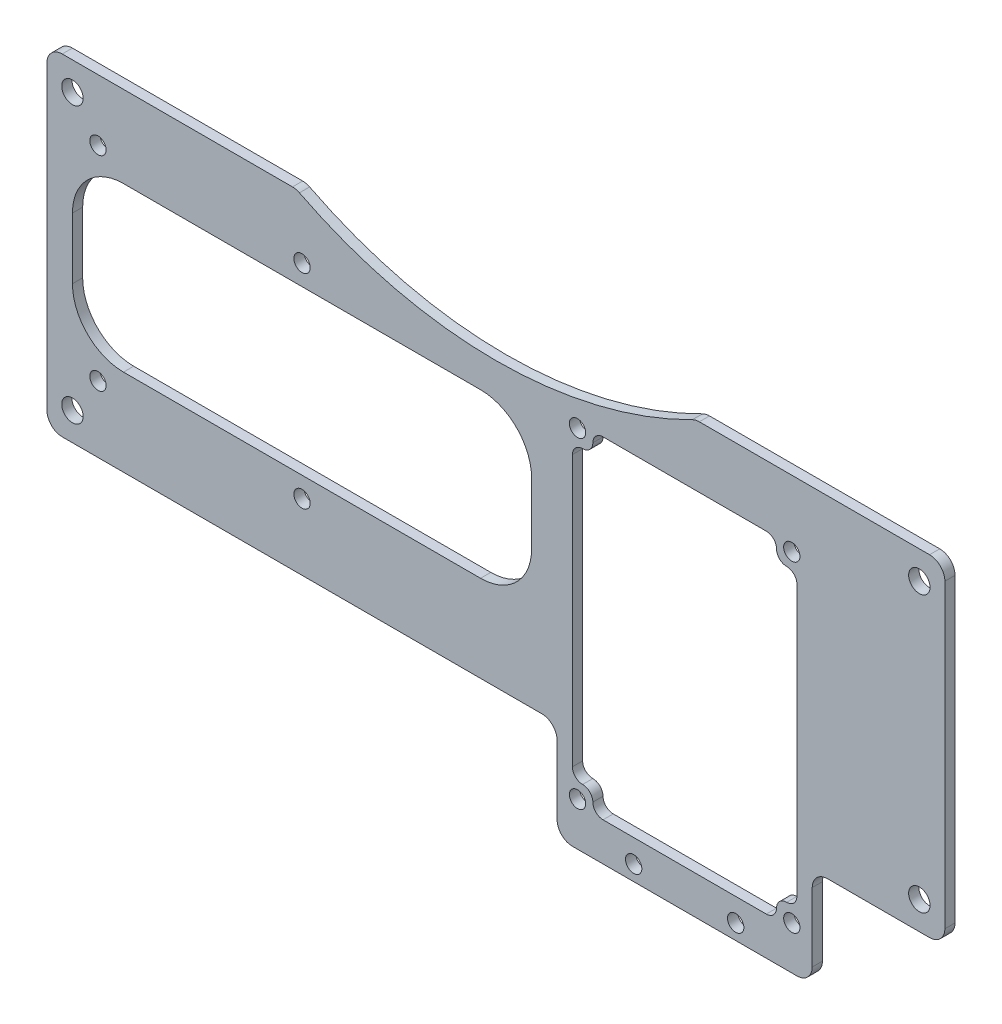
from build123d import *

# Parameters (mm, degrees)
SKETCH_1_W          = 176
SKETCH_1_H          = 65
SKETCH_1_R          = 2.1
EXTRUDE_1_DEPTH     = 2
FILLET_1_R          = 3
SKETCH_2_R          = 85
CUT_EXTRUDE_1_DEPTH = 24
SKETCH_4_W          = 50
SKETCH_4_H          = 19.5
EXTRUDE_2_DEPTH     = 2
FILLET_2_R          = 3
SKETCH_3_R          = 1.6
CUT_EXTRUDE_2_DEPTH = 12
FILLET_3_R          = 2
SKETCH_5_R          = 1.6
CUT_EXTRUDE_3_DEPTH = 12
SKETCH_6_R          = 1.6
CUT_EXTRUDE_4_DEPTH = 12
SKETCH_7_W          = 90
SKETCH_7_H          = 32
CUT_EXTRUDE_5_DEPTH = 10
FILLET_4_R          = 10


with BuildPart() as part:
    # 草图1 → 凸台-拉伸1 (new body)
    with BuildSketch(Plane.XY):
        Rectangle(SKETCH_1_W, SKETCH_1_H)
        with Locations((-83, 27)):
            Circle(SKETCH_1_R, mode=Mode.SUBTRACT)
        with Locations((-83, -27)):
            Circle(SKETCH_1_R, mode=Mode.SUBTRACT)
        with Locations(Location((83, -27, 0), (0, 0, 180))):
            Circle(SKETCH_1_R, mode=Mode.SUBTRACT)
        with Locations(Location((83, 27, 0), (0, 0, 180))):
            Circle(SKETCH_1_R, mode=Mode.SUBTRACT)
    extrude(amount=EXTRUDE_1_DEPTH)

    # 圆角1
    fillet_1_edges = [part.edges().sort_by_distance(p)[0] for p in [
        (-88, 32.5, 1),
        (88, 32.5, 1),
        (88, -32.5, 1),
        (-88, -32.5, 1),
    ]]
    fillet(fillet_1_edges, radius=FILLET_1_R)

    # 草图2 → 切除-拉伸1 (cut)
    with BuildSketch(Plane.XY.offset(2)):
        with Locations((0, 107.95)):
            Circle(SKETCH_2_R)
    extrude(amount=-CUT_EXTRUDE_1_DEPTH, mode=Mode.SUBTRACT)

    # 草图4 → 凸台-拉伸2 (add)
    with BuildSketch(Plane.XY.offset(2)):
        with Locations((37, -42.25)):
            Rectangle(SKETCH_4_W, SKETCH_4_H)
    extrude(amount=-EXTRUDE_2_DEPTH)

    # 圆角2
    fillet_2_edges = [part.edges().sort_by_distance(p)[0] for p in [
        (-39.144571782, 32.5, 1),
        (39.144571782, 32.5, 1),
        (12, -52, 1),
        (12, -32.5, 1),
        (62, -32.5, 1),
        (62, -52, 1),
    ]]
    fillet(fillet_2_edges, radius=FILLET_2_R)

    # 草图3 → 切除-拉伸2 (cut)
    with BuildSketch(Plane.XY.offset(2)):
        with Locations((16, 19.5)):
            Circle(SKETCH_3_R)
        with Locations((58, 19.5)):
            Circle(SKETCH_3_R)
        with Locations((58, -43.5)):
            Circle(SKETCH_3_R)
        with Locations((16, -43.5)):
            Circle(SKETCH_3_R)
        Polygon((19, 20.5), (19, 16.5), (15, 16.5), (15, -40.5), (19, -40.5), (19, -44.5), (55, -44.5), (55, -40.5), (59, -40.5), (59, 16.5), (55, 16.5), (55, 20.5), align=None)
    extrude(amount=-CUT_EXTRUDE_2_DEPTH, mode=Mode.SUBTRACT)

    # 圆角3
    fillet_3_edges = [part.edges().sort_by_distance(p)[0] for p in [
        (55, 16.5, 1),
        (59, 16.5, 1),
        (59, -40.5, 1),
        (55, -40.5, 1),
        (55, -44.5, 1),
        (19, -44.5, 1),
        (19, -40.5, 1),
        (15, -40.5, 1),
        (19, 16.5, 1),
        (19, 20.5, 1),
        (55, 20.5, 1),
        (15, 16.5, 1),
    ]]
    fillet(fillet_3_edges, radius=FILLET_3_R - 0.0001)  # a hair under: the kernel refuses the full size

    # 草图5 → 切除-拉伸3 (cut)
    with BuildSketch(Plane.XY.offset(2)):
        with Locations((27, -49)):
            Circle(SKETCH_5_R)
        with Locations((47, -49)):
            Circle(SKETCH_5_R)
    extrude(amount=-CUT_EXTRUDE_3_DEPTH, mode=Mode.SUBTRACT)

    # 草图6 → 切除-拉伸4 (cut)
    with BuildSketch(Plane.XY.offset(2)):
        with Locations((-78, 20.5)):
            Circle(SKETCH_6_R)
        with Locations((-38, 20.5)):
            Circle(SKETCH_6_R)
        with Locations((-38, -19.5)):
            Circle(SKETCH_6_R)
        with Locations((-78, -19.5)):
            Circle(SKETCH_6_R)
    extrude(amount=-CUT_EXTRUDE_4_DEPTH, mode=Mode.SUBTRACT)

    # 草图7 → 切除-拉伸5 (cut)
    with BuildSketch(Plane.XY.offset(2)):
        with Locations((-38, 0.5)):
            Rectangle(SKETCH_7_W, SKETCH_7_H)
    extrude(amount=-CUT_EXTRUDE_5_DEPTH, mode=Mode.SUBTRACT)

    # 圆角4
    fillet_4_edges = [part.edges().sort_by_distance(p)[0] for p in [
        (-83, -15.5, 1),
        (-83, 16.5, 1),
        (7, 16.5, 1),
        (7, -15.5, 1),
    ]]
    fillet(fillet_4_edges, radius=FILLET_4_R)


solid = part.part
